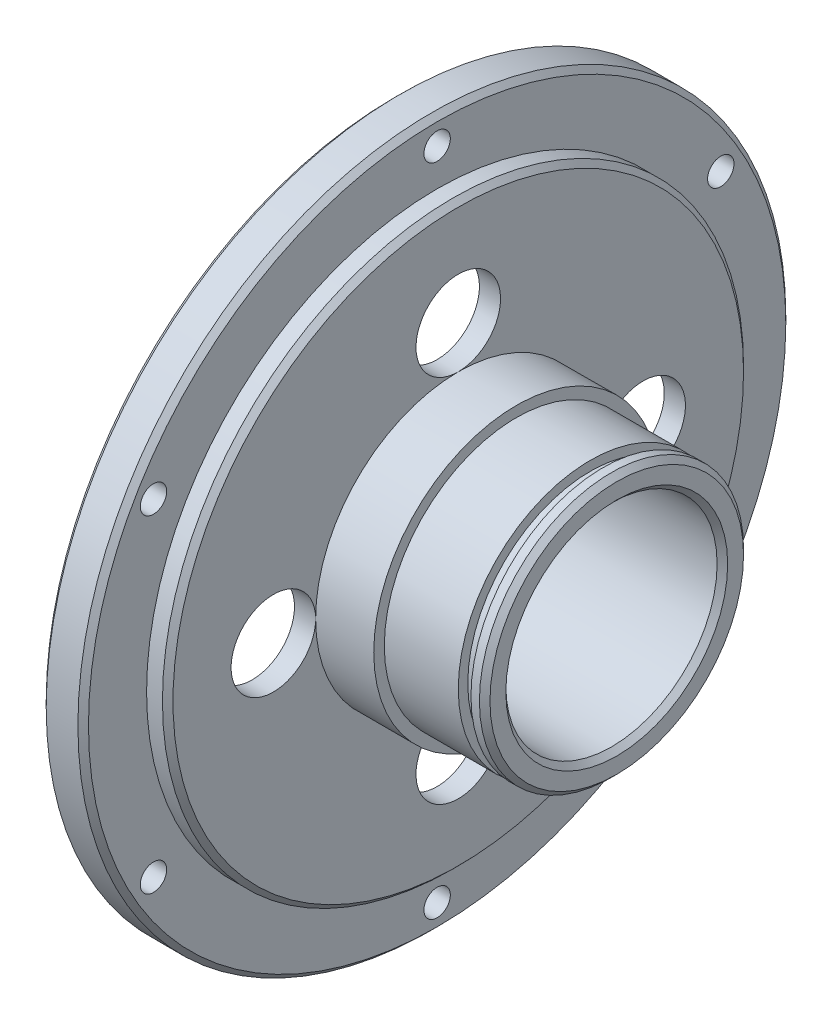
from build123d import *

# Parameters (mm, degrees)
CHAMFER_1_SIZE           = 0.5
SKETCH_2_R               = 4
CUT_EXTRUDE_1_DEPTH      = 50.694064032
PATTERN_CIRCULAR_1_COUNT = 4
HOLE_WIZARD_M3_1_D       = 2.5
PATTERN_CIRCULAR_2_COUNT = 6


with BuildPart() as part:
    # 草图1 → 旋转1 (revolve)
    with BuildSketch(Plane.XY):
        Polygon((4, 33.5), (0, 33.5), (0, 25.5), (4, 25.5), (4, 9), (6, 9), (6, 10), (21, 10), (21, 12.5), (19.7, 12.5), (19.7, 11.6), (18.5, 11.6), (18.5, 12.5), (11.5, 12.5), (11.5, 13.5), (6, 13.5), (6, 27.5), (4, 27.5), align=None)
    revolve(axis=Axis((0, 0, 0), (1, 0, 0)))

    # 倒角1
    chamfer_1_edges = [part.edges().sort_by_distance(p)[0] for p in [
        (0, -33.5, 0),
        (4, -33.5, 0),
        (6, -27.5, 0),
        (21, -12.5, 0),
        (21, -10, 0),
        (4, -25.5, 0),
        (0, -25.5, 0),
    ]]
    chamfer(chamfer_1_edges, length=CHAMFER_1_SIZE)

    # 草图2 → 切除-拉伸1 (cut, symmetric)
    with BuildSketch(Plane(origin=(6, 0, 0), x_dir=(0, 0, -1), z_dir=(1, 0, 0))):
        with Locations((0, 17.5)):
            Circle(SKETCH_2_R)
    cut_extrude_1 = extrude(amount=CUT_EXTRUDE_1_DEPTH, both=True, mode=Mode.SUBTRACT)

    # 阵列(圆周)1: 切除-拉伸1 ×4 about axis
    pattern_circular_1_axis = Axis((0, 0, 0), (-1, 0, 0))
    for i in range(1, PATTERN_CIRCULAR_1_COUNT):
        add(cut_extrude_1.rotate(pattern_circular_1_axis, i * 360 / PATTERN_CIRCULAR_1_COUNT), mode=Mode.SUBTRACT)

    # M3 螺纹孔1 (through all)
    with Locations(Plane(origin=(4, 0, 0), x_dir=(0, 0, -1), z_dir=(1, 0, 0))):
        with Locations((0, 31)):
            hole_wizard_m3_1 = Hole(HOLE_WIZARD_M3_1_D / 2)

    # 阵列(圆周)2: M3 螺纹孔1 ×6 about axis
    pattern_circular_2_axis = Axis((0, 0, 0), (-1, 0, 0))
    for i in range(1, PATTERN_CIRCULAR_2_COUNT):
        add(hole_wizard_m3_1.rotate(pattern_circular_2_axis, i * 360 / PATTERN_CIRCULAR_2_COUNT), mode=Mode.SUBTRACT)


solid = part.part
